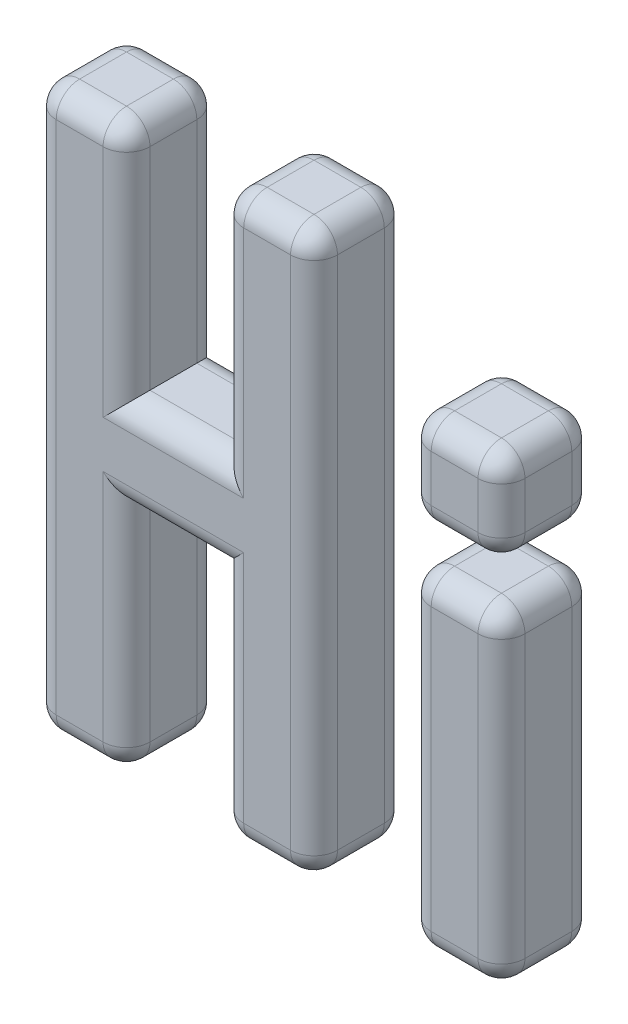
from build123d import *

# Parameters (mm, degrees)
BOSS_EXTRUDE1_DEPTH   = 10
SKETCH1_W             = 10
SKETCH1_H             = 35
BOSS_EXTRUDE1_2_DEPTH = 10
SKETCH1_H_2           = 10
BOSS_EXTRUDE1_3_DEPTH = 10
FILLET2_R             = 2.5
FILLET3_R             = 2.5
FILLET4_R             = 2.5
FILLET5_R             = 2.5
FILLET6_R             = 2.5
FILLET7_R             = 2.5
FILLET8_R             = 2.5
FILLET9_R             = 2.5
FILLET10_R            = 2.5
FILLET11_R            = 2.5
FILLET12_R            = 2.5
FILLET13_R            = 2.5
FILLET14_R            = 2.5
FILLET15_R            = 2.5
FILLET16_R            = 2.5
FILLET17_R            = 2.5
FILLET18_R            = 2.5
FILLET19_R            = 2.5
FILLET20_R            = 2.5
FILLET21_R            = 2.5
FILLET22_R            = 2.5
FILLET23_R            = 2.5
FILLET24_R            = 2.5


with BuildPart() as part:
    # Sketch1 → Boss-Extrude1 (new body)
    with BuildSketch(Plane.XY):
        Polygon((-86.338028169, -9.718309859), (-86.338028169, 15.281690141), (-76.338028169, 15.281690141), (-76.338028169, -9.718309859), (-66.338028169, -9.718309859), (-66.338028169, 50.281690141), (-76.338028169, 50.281690141), (-76.338028169, 25.281690141), (-86.338028169, 25.281690141), (-86.338028169, 50.281690141), (-96.338028169, 50.281690141), (-96.338028169, -9.718309859), align=None)
    extrude(amount=BOSS_EXTRUDE1_DEPTH)

    # Fillet2
    fillet2_edges = [part.edges().sort_by_distance(p)[0] for p in [
        (-96.338028169, 50.281690141, 5),
    ]]
    fillet(fillet2_edges, radius=FILLET2_R)

    # Fillet3
    fillet3_edges = [part.edges().sort_by_distance(p)[0] for p in [
        (-86.338028169, 50.281690141, 5),
    ]]
    fillet(fillet3_edges, radius=FILLET3_R)

    # Fillet4
    fillet4_edges = [part.edges().sort_by_distance(p)[0] for p in [
        (-66.338028169, 50.281690141, 5),
    ]]
    fillet(fillet4_edges, radius=FILLET4_R)

    # Fillet5
    fillet5_edges = [part.edges().sort_by_distance(p)[0] for p in [
        (-76.338028169, 50.281690141, 5),
    ]]
    fillet(fillet5_edges, radius=FILLET5_R)

    # Fillet6
    fillet6_edges = [part.edges().sort_by_distance(p)[0] for p in [
        (-96.338028169, -9.718309859, 5),
    ]]
    fillet(fillet6_edges, radius=FILLET6_R)

    # Fillet7
    fillet7_edges = [part.edges().sort_by_distance(p)[0] for p in [
        (-86.338028169, -9.718309859, 5),
    ]]
    fillet(fillet7_edges, radius=FILLET7_R)

    # Fillet9
    fillet9_edges = [part.edges().sort_by_distance(p)[0] for p in [
        (-66.338028169, -9.718309859, 5),
    ]]
    fillet(fillet9_edges, radius=FILLET9_R)

    # Fillet10
    fillet10_edges = [part.edges().sort_by_distance(p)[0] for p in [
        (-76.338028169, -9.718309859, 5),
    ]]
    fillet(fillet10_edges, radius=FILLET10_R)

    # Fillet16
    fillet16_edges = [part.edges().sort_by_distance(p)[0] for p in [
        (-86.338028169, 36.531690141, 10),
        (-87.070261216, 49.549457094, 10),
        (-91.338028169, 50.281690141, 10),
        (-95.605795122, 49.549457094, 10),
        (-86.338028169, 4.031690141, 10),
        (-87.070261216, -8.986076812, 10),
        (-91.338028169, -9.718309859, 10),
        (-95.605795122, -8.986076812, 10),
        (-96.338028169, 20.281690141, 10),
    ]]
    fillet(fillet16_edges, radius=FILLET16_R)

    # Fillet17
    fillet17_edges = [part.edges().sort_by_distance(p)[0] for p in [
        (-76.338028169, 36.531690141, 10),
        (-75.605795122, 49.549457094, 10),
        (-71.338028169, 50.281690141, 10),
        (-67.070261216, 49.549457094, 10),
        (-76.338028169, 4.031690141, 10),
        (-75.605795122, -8.986076812, 10),
        (-71.338028169, -9.718309859, 10),
        (-67.070261216, -8.986076812, 10),
        (-66.338028169, 20.281690141, 10),
    ]]
    fillet(fillet17_edges, radius=FILLET17_R)

    # Fillet22
    fillet22_edges = [part.edges().sort_by_distance(p)[0] for p in [
        (-86.338028169, 36.531690141, 0),
        (-87.070261216, 49.549457094, 0),
        (-91.338028169, 50.281690141, 0),
        (-95.605795122, 49.549457094, 0),
        (-86.338028169, 4.031690141, 0),
        (-87.070261216, -8.986076812, 0),
        (-91.338028169, -9.718309859, 0),
        (-95.605795122, -8.986076812, 0),
        (-76.338028169, 36.531690141, 0),
        (-75.605795122, 49.549457094, 0),
        (-67.070261216, 49.549457094, 0),
        (-76.338028169, 4.031690141, 0),
        (-75.605795122, -8.986076812, 0),
        (-71.338028169, -9.718309859, 0),
        (-67.070261216, -8.986076812, 0),
        (-96.338028169, 20.281690141, 0),
        (-66.338028169, 20.281690141, 0),
    ]]
    fillet(fillet22_edges, radius=FILLET22_R)

    # Fillet23
    fillet23_edges = [part.edges().sort_by_distance(p)[0] for p in [
        (-81.338028169, 15.281690141, 0),
        (-81.338028169, 25.281690141, 0),
    ]]
    fillet(fillet23_edges, radius=FILLET23_R)

    # Fillet24
    fillet24_edges = [part.edges().sort_by_distance(p)[0] for p in [
        (-81.338028169, 15.281690141, 10),
        (-81.338028169, 25.281690141, 10),
    ]]
    fillet(fillet24_edges, radius=FILLET24_R)


with BuildPart() as body_2:
    # Sketch1 → Boss-Extrude1 2 (new body)
    with BuildSketch(Plane.XY):
        with Locations((-51.338028169, 7.781690141)):
            Rectangle(SKETCH1_W, SKETCH1_H)
    extrude(amount=BOSS_EXTRUDE1_2_DEPTH)

    # Fillet8
    fillet8_edges = [body_2.edges().sort_by_distance(p)[0] for p in [
        (-46.338028169, -9.718309859, 5),
    ]]
    fillet(fillet8_edges, radius=FILLET8_R)

    # Fillet11
    fillet11_edges = [body_2.edges().sort_by_distance(p)[0] for p in [
        (-56.338028169, -9.718309859, 5),
    ]]
    fillet(fillet11_edges, radius=FILLET11_R)

    # Fillet12
    fillet12_edges = [body_2.edges().sort_by_distance(p)[0] for p in [
        (-46.338028169, 25.281690141, 5),
    ]]
    fillet(fillet12_edges, radius=FILLET12_R)

    # Fillet15
    fillet15_edges = [body_2.edges().sort_by_distance(p)[0] for p in [
        (-56.338028169, 25.281690141, 5),
    ]]
    fillet(fillet15_edges, radius=FILLET15_R)

    # Fillet18
    fillet18_edges = [body_2.edges().sort_by_distance(p)[0] for p in [
        (-47.070261216, 24.549457094, 10),
        (-51.338028169, 25.281690141, 10),
        (-55.605795122, 24.549457094, 10),
        (-55.605795122, -8.986076812, 10),
        (-51.338028169, -9.718309859, 10),
        (-47.070261216, -8.986076812, 10),
        (-56.338028169, 7.781690141, 10),
        (-46.338028169, 7.781690141, 10),
    ]]
    fillet(fillet18_edges, radius=FILLET18_R)

    # Fillet21
    fillet21_edges = [body_2.edges().sort_by_distance(p)[0] for p in [
        (-47.070261216, 24.549457094, 0),
        (-51.338028169, 25.281690141, 0),
        (-55.605795122, 24.549457094, 0),
        (-55.605795122, -8.986076812, 0),
        (-51.338028169, -9.718309859, 0),
        (-47.070261216, -8.986076812, 0),
        (-56.338028169, 7.781690141, 0),
        (-46.338028169, 7.781690141, 0),
    ]]
    fillet(fillet21_edges, radius=FILLET21_R)


with BuildPart() as body_3:
    # Sketch1 → Boss-Extrude1 3 (new body)
    with BuildSketch(Plane.XY):
        with Locations((-51.338028169, 34.633802817)):
            Rectangle(SKETCH1_W, SKETCH1_H_2)
    extrude(amount=BOSS_EXTRUDE1_3_DEPTH)

    # Fillet13
    fillet13_edges = [body_3.edges().sort_by_distance(p)[0] for p in [
        (-46.338028169, 29.633802817, 5),
    ]]
    fillet(fillet13_edges, radius=FILLET13_R)

    # Fillet14
    fillet14_edges = [body_3.edges().sort_by_distance(p)[0] for p in [
        (-56.338028169, 29.633802817, 5),
        (-56.338028169, 39.633802817, 5),
        (-46.338028169, 39.633802817, 5),
    ]]
    fillet(fillet14_edges, radius=FILLET14_R)

    # Fillet19
    fillet19_edges = [body_3.edges().sort_by_distance(p)[0] for p in [
        (-55.605795122, 38.90156977, 10),
        (-56.338028169, 34.633802817, 10),
        (-55.605795122, 30.366035864, 10),
        (-47.070261216, 30.366035864, 10),
        (-46.338028169, 34.633802817, 10),
        (-47.070261216, 38.90156977, 10),
        (-51.338028169, 29.633802817, 10),
        (-51.338028169, 39.633802817, 10),
    ]]
    fillet(fillet19_edges, radius=FILLET19_R)

    # Fillet20
    fillet20_edges = [body_3.edges().sort_by_distance(p)[0] for p in [
        (-47.070261216, 38.90156977, 0),
        (-55.605795122, 38.90156977, 0),
        (-56.338028169, 34.633802817, 0),
        (-55.605795122, 30.366035864, 0),
        (-51.338028169, 29.633802817, 0),
        (-47.070261216, 30.366035864, 0),
        (-51.338028169, 39.633802817, 0),
        (-46.338028169, 34.633802817, 0),
    ]]
    fillet(fillet20_edges, radius=FILLET20_R)


solid = Compound([part.part, body_2.part, body_3.part])
